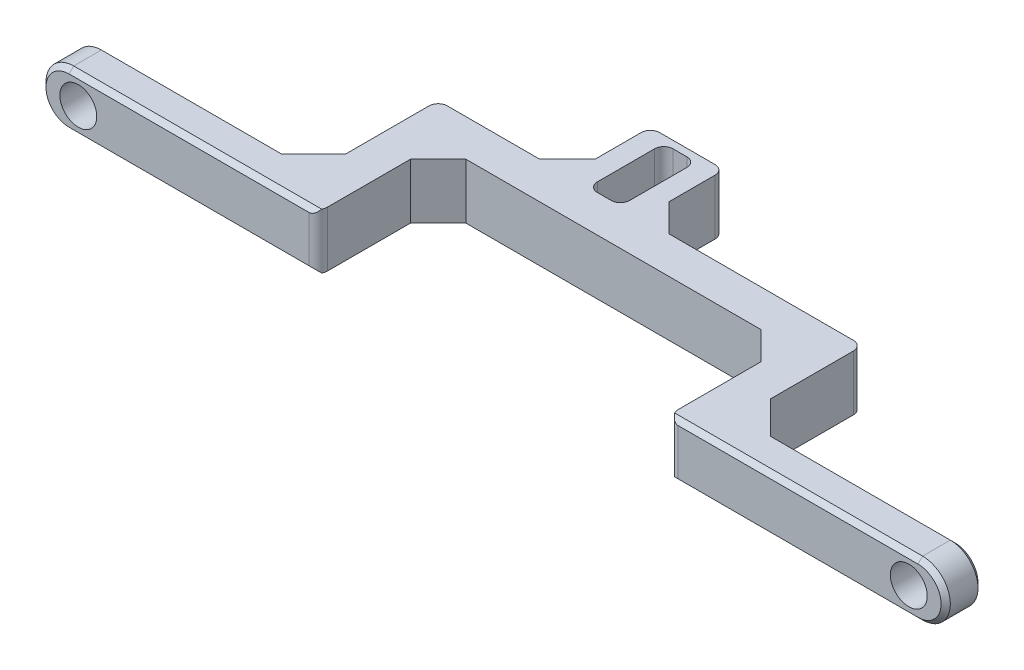
from build123d import *

# Parameters (mm, degrees)
CROQUIS1_R                = 3
SALIENTE_EXTRUIR1_DEPTH   = 4
SALIENTE_EXTRUIR1_2_DEPTH = 4
CROQUIS2_W                = 90
CROQUIS2_H                = 6
SALIENTE_EXTRUIR2_DEPTH   = 4
CROQUIS4_W                = 46
CROQUIS4_H                = 13
SALIENTE_EXTRUIR3_DEPTH   = 6
CROQUIS5_W                = 38
CROQUIS5_H                = 13
CORTAR_EXTRUIR1_DEPTH     = 95.09569597
CROQUIS6_W                = 8
CROQUIS6_H                = 9
SALIENTE_EXTRUIR4_DEPTH   = 3
CROQUIS7_W                = 3.5
CROQUIS7_H                = 8.2
CORTAR_EXTRUIR2_DEPTH     = 96.754895436
CHAFL_N1_SIZE             = 3
REDONDEO1_R               = 1
CROQUIS8_R                = 1.75
CORTAR_EXTRUIR3_DEPTH     = 97.612628574
SALIENTE_EXTRUIR5_DEPTH   = 4
CROQUIS10_R               = 2
CORTAR_EXTRUIR4_DEPTH     = 97.586748573
CHAFL_N2_SIZE             = 0.5


with BuildPart() as part:
    # Croquis1 → Saliente-Extruir1 (new body)
    with BuildSketch(Plane.XY):
        Circle(CROQUIS1_R)
    extrude(amount=SALIENTE_EXTRUIR1_DEPTH)



with BuildPart() as body_2:
    # Croquis1 → Saliente-Extruir1 2 (new body)
    with BuildSketch(Plane.XY):
        with Locations((90, 0)):
            Circle(CROQUIS1_R)
    extrude(amount=SALIENTE_EXTRUIR1_2_DEPTH)


with BuildPart() as part_1:
    add(part.part)

    add(body_2.part)  # Saliente-Extruir2 merges body 2
    # Croquis2 → Saliente-Extruir2 (add)
    with BuildSketch(Plane.XY):
        with Locations((45, 0)):
            Rectangle(CROQUIS2_W, CROQUIS2_H)
    extrude(amount=SALIENTE_EXTRUIR2_DEPTH)

    # Croquis4 → Saliente-Extruir3 (add)
    with BuildSketch(Plane(origin=(0, 3, 0), x_dir=(1, 0, 0), z_dir=(0, 1, 0))):
        with Locations((45, 6.5)):
            Rectangle(CROQUIS4_W, CROQUIS4_H)
    extrude(amount=-SALIENTE_EXTRUIR3_DEPTH)

    # Croquis5 → Cortar-Extruir1 (cut, through all)
    with BuildSketch(Plane(origin=(0, 3, 0), x_dir=(1, 0, 0), z_dir=(0, 1, 0))):
        with Locations((45, 2.5)):
            Rectangle(CROQUIS5_W, CROQUIS5_H)
    extrude(amount=-CORTAR_EXTRUIR1_DEPTH, mode=Mode.SUBTRACT)

    # Croquis6 → Saliente-Extruir4 (add, symmetric)
    with BuildSketch(Plane(origin=(0, 0, 0), x_dir=(1, 0, 0), z_dir=(0, 1, 0))):
        with Locations((40, 17.5)):
            Rectangle(CROQUIS6_W, CROQUIS6_H)
    extrude(amount=SALIENTE_EXTRUIR4_DEPTH, both=True)

    # Croquis7 → Cortar-Extruir2 (cut, through all)
    with BuildSketch(Plane(origin=(0, 3, 0), x_dir=(1, 0, 0), z_dir=(0, 1, 0))):
        with Locations((40, 17.1)):
            Rectangle(CROQUIS7_W, CROQUIS7_H)
    extrude(amount=-CORTAR_EXTRUIR2_DEPTH, mode=Mode.SUBTRACT)

    # Chaflán1
    chafl_n1_edges = [part_1.edges().sort_by_distance(p)[0] for p in [
        (22, 0, 0),
        (68, 0, 0),
        (26, 0, -9),
        (64, 0, -9),
        (36, 0, -13),
        (44, 0, -13),
    ]]
    chamfer(chafl_n1_edges, length=CHAFL_N1_SIZE)

    # Redondeo1
    redondeo1_edges = [part_1.edges().sort_by_distance(p)[0] for p in [
        (22, 0, -13),
        (68, 0, -13),
        (26, 0, 4),
        (64, 0, 4),
        (36, 0, -22),
        (44, 0, -22),
        (38.25, 0, -13),
        (38.25, 0, -21.2),
        (41.75, 0, -21.2),
        (41.75, 0, -13),
    ]]
    fillet(redondeo1_edges, radius=REDONDEO1_R)

    # Croquis8 → Cortar-Extruir3 (cut, through all)
    with BuildSketch(Plane.XY.offset(4)):
        Circle(CROQUIS8_R)
        with Locations((90, 0)):
            Circle(CROQUIS8_R)
    extrude(amount=-CORTAR_EXTRUIR3_DEPTH, mode=Mode.SUBTRACT)

    # Croquis9 → Saliente-Extruir5 (add)
    with BuildSketch(Plane.XY.offset(4)):
        with BuildLine():
            Line((-1, 3), (0, 3))
            Line((0, 3), (0, 2.5))
            ThreePointArc((0, 2.5), (-2.5, 0), (0, -2.5))
            Line((0, -2.5), (0, -3))
            Line((0, -3), (-1, -3))
            ThreePointArc((-1, -3), (-4, 0), (-1, 3))
        make_face()
    saliente_extruir5 = extrude(amount=-SALIENTE_EXTRUIR5_DEPTH)

    # Simetría1: Saliente-Extruir5 across plane
    add(saliente_extruir5.mirror(Plane(origin=(45, 0, 0), x_dir=(0, 0, 1), z_dir=(1, 0, 0))))

    # Croquis10 → Cortar-Extruir4 (cut, through all)
    with BuildSketch(Plane(origin=(0, 0, 0), x_dir=(-1, 0, 0), z_dir=(0, 0, -1))):
        Circle(CROQUIS10_R)
        with Locations((-90, 0)):
            Circle(CROQUIS10_R)
    extrude(amount=-CORTAR_EXTRUIR4_DEPTH, mode=Mode.SUBTRACT)

    # Chaflán2
    # the kernel refuses this chamfer: 0.5 mm, written as the material it takes off along each edge
    with BuildSketch(Plane(origin=(63.714158506, 3, 4), x_dir=(0, 0.027495876610586487, -0.9996219169112968), z_dir=(1, 0, 0)), Plane(origin=(-1, -3, 4), x_dir=(0, 0.9996219169112968, 0.027495876610585623), z_dir=(1, 0, 0)), Plane(origin=(-1, 3, 4), x_dir=(0, 0.027495876610590796, -0.9996219169112965), z_dir=(1, 0, 0)), Plane(origin=(63.714158506, -3, 4), x_dir=(0, 0.9996219169112968, 0.027495876610585623), z_dir=(1, 0, 0))) as chafl_n2_piece_1:
        Polygon((CHAFL_N2_SIZE * 0.999621916911, -CHAFL_N2_SIZE * 0.0274958766106), (-CHAFL_N2_SIZE * 0.0274958766106, -CHAFL_N2_SIZE * 0.999621916911), (0, 0), align=None)
    extrude(amount=27.285841494, mode=Mode.SUBTRACT)
    with BuildSketch(Plane(origin=(-1, 0, 0), x_dir=(0, -1, 0), z_dir=(1, 0, 0))) as chafl_n2_piece_2:
        Polygon((3, -CHAFL_N2_SIZE), (3 - CHAFL_N2_SIZE, 0), (3, 0), align=None)
    revolve(axis=Axis((-1, 0, 0), (0, 0, -1)), revolution_arc=180, mode=Mode.SUBTRACT)
    with BuildSketch(Plane(origin=(-1, 0, 4), x_dir=(0, -1, 0), z_dir=(1, 0, 0))) as chafl_n2_piece_3:
        Polygon((3 - CHAFL_N2_SIZE, 0), (3, CHAFL_N2_SIZE), (3, 0), align=None)
    revolve(axis=Axis((-1, 0, 4), (0, 0, -1)), revolution_arc=180, mode=Mode.SUBTRACT)
    with BuildSketch(Plane(origin=(91, 0, 4), x_dir=(0, -1, 0), z_dir=(-1, 0, 0))) as chafl_n2_piece_4:
        Polygon((3, -CHAFL_N2_SIZE), (3 - CHAFL_N2_SIZE, 0), (3, 0), align=None)
    revolve(axis=Axis((91, 0, 4), (0, 0, 1)), revolution_arc=180, mode=Mode.SUBTRACT)
    with BuildSketch(Plane(origin=(91, 0, 0), x_dir=(0, -1, 0), z_dir=(-1, 0, 0))) as chafl_n2_piece_5:
        Polygon((3 - CHAFL_N2_SIZE, 0), (3, CHAFL_N2_SIZE), (3, 0), align=None)
    revolve(axis=Axis((91, 0, 0), (0, 0, 1)), revolution_arc=180, mode=Mode.SUBTRACT)
    with BuildSketch(Plane(origin=(91, -3, 0), x_dir=(0, 0.9996219169112968, -0.027495876610586365), z_dir=(-1, 0, 0))) as chafl_n2_piece_6_section:
        Polygon((CHAFL_N2_SIZE * 0.999621916911, -CHAFL_N2_SIZE * 0.0274958766106), (-CHAFL_N2_SIZE * 0.0274958766106, -CHAFL_N2_SIZE * 0.999621916911), (0, 0), align=None)
    chafl_n2_piece_6 = extrude(amount=21.285841494, mode=Mode.PRIVATE)
    chafl_n2_piece_6 = split(chafl_n2_piece_6, bisect_by=Plane(origin=(80.80759364, -2.786891573, 9.80759364), z_dir=(0.7071067811865476, 0, -0.7071067811865476)), keep=Keep.TOP, mode=Mode.PRIVATE)
    add(chafl_n2_piece_6, mode=Mode.SUBTRACT)
    with BuildSketch(Plane(origin=(20.285841494, -3, 0), x_dir=(0, 0.9996219169112968, -0.027495876610586365), z_dir=(-1, 0, 0))) as chafl_n2_piece_7_section:
        Polygon((CHAFL_N2_SIZE * 0.999621916911, -CHAFL_N2_SIZE * 0.0274958766106), (-CHAFL_N2_SIZE * 0.0274958766106, -CHAFL_N2_SIZE * 0.999621916911), (0, 0), align=None)
    chafl_n2_piece_7 = extrude(amount=21.285841494, mode=Mode.PRIVATE)
    chafl_n2_piece_7 = split(chafl_n2_piece_7, bisect_by=Plane(origin=(14.099970333, -2.8351922, 4.900029667), z_dir=(-0.7071067811865476, 0, -0.7071067811865476)), keep=Keep.TOP, mode=Mode.PRIVATE)
    add(chafl_n2_piece_7, mode=Mode.SUBTRACT)
    with BuildSketch(Plane(origin=(20.285841494, 3, 0), x_dir=(0, 0.027495876610586494, 0.9996219169112968), z_dir=(-1, 0, 0))) as chafl_n2_piece_8_section:
        Polygon((CHAFL_N2_SIZE * 0.999621916911, -CHAFL_N2_SIZE * 0.0274958766106), (-CHAFL_N2_SIZE * 0.0274958766106, -CHAFL_N2_SIZE * 0.999621916911), (0, 0), align=None)
    chafl_n2_piece_8 = extrude(amount=21.285841494, mode=Mode.PRIVATE)
    chafl_n2_piece_8 = split(chafl_n2_piece_8, bisect_by=Plane(origin=(14.099970416, 2.835192201, 4.900029584), z_dir=(-0.7071067811865476, 0, -0.7071067811865476)), keep=Keep.TOP, mode=Mode.PRIVATE)
    add(chafl_n2_piece_8, mode=Mode.SUBTRACT)
    with BuildSketch(Plane(origin=(91, 3, 0), x_dir=(0, 0.027495876610590803, 0.9996219169112965), z_dir=(-1, 0, 0))) as chafl_n2_piece_9_section:
        Polygon((CHAFL_N2_SIZE * 0.999621916911, -CHAFL_N2_SIZE * 0.0274958766106), (-CHAFL_N2_SIZE * 0.0274958766106, -CHAFL_N2_SIZE * 0.999621916911), (0, 0), align=None)
    chafl_n2_piece_9 = extrude(amount=21.285841494, mode=Mode.PRIVATE)
    chafl_n2_piece_9 = split(chafl_n2_piece_9, bisect_by=Plane(origin=(75.900029584, 2.835192201, 4.900029584), z_dir=(0.7071067811865476, 0, -0.7071067811865476)), keep=Keep.TOP, mode=Mode.PRIVATE)
    add(chafl_n2_piece_9, mode=Mode.SUBTRACT)


solid = part_1.part
